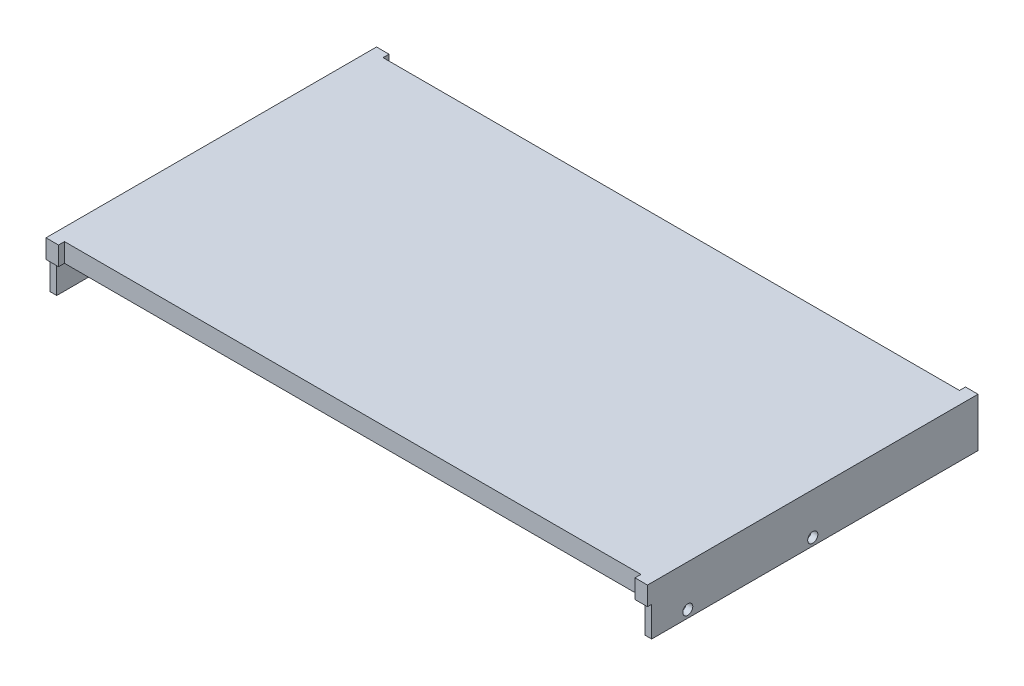
from build123d import *

# Parameters (mm, degrees)
SKETCH1_W           = 240
SKETCH1_H           = 351.15
BOSS_EXTRUDE3_DEPTH = 21
SKETCH5_W           = 248.975913499
SKETCH5_H           = 113.170869772
CUT_EXTRUDE5_DEPTH  = 254
CAVITY1_START       = -93.176553254
CAVITY1_DEPTH       = 230
SKETCH6_W           = 230
SKETCH6_H           = 2.384694545
CUT_EXTRUDE6_DEPTH  = 10
SKETCH7_W           = 329.692379319
SKETCH7_H           = 158.801284786
CUT_EXTRUDE10_DEPTH = 41
SKETCH11_W          = 230
SKETCH11_H          = 3.476591165
CUT_EXTRUDE14_DEPTH = 10
SKETCH9_W           = 2.6
SKETCH9_H           = 130.2
BOSS_EXTRUDE4_DEPTH = 12
SKETCH14_R          = 2.021585834
CUT_EXTRUDE15_DEPTH = 10
CUT_EXTRUDE16_START = -10
SKETCH13_R          = 2.021585834
CUT_EXTRUDE16_DEPTH = 10
SKETCH16_R          = 2
CUT_EXTRUDE17_DEPTH = 10
CUT_EXTRUDE18_START = -10
SKETCH15_R          = 2
CUT_EXTRUDE18_DEPTH = 10


with BuildPart() as part:
    # Sketch1 → Boss-Extrude3 (new body)
    with BuildSketch(Plane(origin=(0, 0, 0), x_dir=(1, 0, 0), z_dir=(0, 1, 0))):
        with Locations((21.823446746, 98.176553254)):
            Rectangle(SKETCH1_W, SKETCH1_H)
    extrude(amount=BOSS_EXTRUDE3_DEPTH)

    # Sketch5 → Cut-Extrude5 (cut)
    with BuildSketch(Plane(origin=(0, 0, -54.481553254), x_dir=(-1, 0, 0), z_dir=(0, 0, -1))):
        with Locations((-20.8478358, 4.110963623)):
            Rectangle(SKETCH5_W, SKETCH5_H)
    extrude(amount=CUT_EXTRUDE5_DEPTH, mode=Mode.SUBTRACT)

    # Cavity1: read off the stored shape, not the designer's step
    # Cavity1 outline → Cavity1 (cut)
    with BuildSketch(Plane.YZ.offset(CAVITY1_START)):
        Polygon((18.5, 60.403141291), (13.5, 67.518446746), (13.5, 67.903141291), (18.5, 67.903141291), (13.5, 75.018446746), (5, 75.018446746), (5, -54.481553254), (13.5, -54.481553254), (13.5, -52.096858709), (18.5, -52.096858709), (13.5, -44.981553254), (13.5, -44.596858709), (18.5, -44.596858709), (13.5, -37.481553254), (13.5, -37.096858709), (18.5, -37.096858709), (13.5, -29.981553254), (13.5, -29.596858709), (18.5, -29.596858709), (13.5, -22.481553254), (13.5, -22.096858709), (18.5, -22.096858709), (13.5, -14.981553254), (13.5, -14.596858709), (18.5, -14.596858709), (13.5, -7.481553254), (13.5, -7.096858709), (18.5, -7.096858709), (13.5, 0.018446746), (13.5, 0.403141291), (18.5, 0.403141291), (13.5, 7.518446746), (13.5, 7.903141291), (18.5, 7.903141291), (13.5, 15.018446746), (13.5, 15.403141291), (18.5, 15.403141291), (13.5, 22.518446746), (13.5, 22.903141291), (18.5, 22.903141291), (13.5, 30.018446746), (13.5, 30.403141291), (18.5, 30.403141291), (13.5, 37.518446746), (13.5, 37.903141291), (18.5, 37.903141291), (13.5, 45.018446746), (13.5, 45.403141291), (18.5, 45.403141291), (13.5, 52.518446746), (13.5, 52.903141291), (18.5, 52.903141291), (13.5, 60.018446746), (13.5, 60.403141291), align=None)
    extrude(amount=CAVITY1_DEPTH, mode=Mode.SUBTRACT)

    # Sketch6 → Cut-Extrude6 (cut)
    with BuildSketch(Plane(origin=(0, 13.5, 0), x_dir=(-1, 0, 0), z_dir=(0, -1, 0))):
        with Locations((-21.823446746, 53.289205982)):
            Rectangle(SKETCH6_W, SKETCH6_H)
    extrude(amount=-CUT_EXTRUDE6_DEPTH, mode=Mode.SUBTRACT)

    # Sketch7 → Cut-Extrude10 (cut)
    with BuildSketch(Plane(origin=(0, 13.5, 0), x_dir=(-1, 0, 0), z_dir=(0, -1, 0))):
        with Locations((-33.84938791, -12.885366014)):
            Rectangle(SKETCH7_W, SKETCH7_H)
    extrude(amount=CUT_EXTRUDE10_DEPTH, mode=Mode.SUBTRACT)

    # Sketch11 → Cut-Extrude14 (cut)
    with BuildSketch(Plane.XZ.offset(-13.5)):
        with Locations((21.823446746, 76.756742329)):
            Rectangle(SKETCH11_W, SKETCH11_H)
    extrude(amount=-CUT_EXTRUDE14_DEPTH, mode=Mode.SUBTRACT)

    # Sketch9 → Boss-Extrude4 (add)
    with BuildSketch(Plane.XZ.offset(-13.5)):
        with Locations((-96.876553254, 10.618446746)):
            Rectangle(SKETCH9_W, SKETCH9_H)
        with Locations((140.523446746, 10.618446746)):
            Rectangle(SKETCH9_W, SKETCH9_H)
    extrude(amount=BOSS_EXTRUDE4_DEPTH)

    # Sketch14 → Cut-Extrude15 (cut)
    with BuildSketch(Plane.ZY.offset(98.176553254)):
        with Locations((11.458446746, 4.5)):
            Circle(SKETCH14_R)
    extrude(amount=-CUT_EXTRUDE15_DEPTH, mode=Mode.SUBTRACT)

    # Sketch13 → Cut-Extrude16 (cut)
    with BuildSketch(Plane(origin=(141.823446746, 0, 0), x_dir=(0, 0, -1), z_dir=(1, 0, 0)).offset(CUT_EXTRUDE16_START)):
        with Locations(Location((-11.458446746, 4.5, 0), (0, 0, 180))):
            Circle(SKETCH13_R)
    extrude(amount=CUT_EXTRUDE16_DEPTH, mode=Mode.SUBTRACT)

    # Sketch16 → Cut-Extrude17 (cut)
    with BuildSketch(Plane(origin=(141.823446746, 0, 0), x_dir=(0, 0, -1), z_dir=(1, 0, 0))):
        with Locations((-61.32678821, 4.5)):
            Circle(SKETCH16_R)
    extrude(amount=-CUT_EXTRUDE17_DEPTH, mode=Mode.SUBTRACT)

    # Sketch15 → Cut-Extrude18 (cut)
    with BuildSketch(Plane.ZY.offset(98.176553254).offset(CUT_EXTRUDE18_START)):
        with Locations(Location((61.32678821, 4.5, 0), (0, 0, 180))):
            Circle(SKETCH15_R)
    extrude(amount=CUT_EXTRUDE18_DEPTH, mode=Mode.SUBTRACT)


solid = part.part
